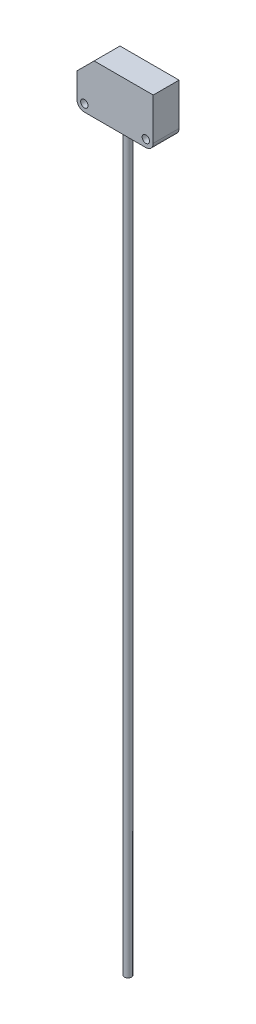
from build123d import *

# Parameters (mm, degrees)
BOSS_EXTRU_1_DEPTH      = 10.5
ESQUISSE2_R             = 1.5
ENL_V_MAT_EXTRU_1_DEPTH = 39.356876828
CONG_1_R                = 3
ESQUISSE3_W             = 18
ESQUISSE3_H             = 10.5
BOSS_EXTRU_2_DEPTH      = 0.01
ESQUISSE4_R             = 1.5
BOSS_EXTRU_3_DEPTH      = 300


with BuildPart() as part:
    # Esquisse1 → Boss.-Extru.1 (new body)
    with BuildSketch(Plane.XY):
        Polygon((0, 0), (31, 0), (31, 20), (7, 20), (0, 13), align=None)
    extrude(amount=-BOSS_EXTRU_1_DEPTH)

    # Esquisse2 → Enlèv. mat.-Extru.1 (cut, through all)
    with BuildSketch(Plane.XY):
        with Locations((3, 3)):
            Circle(ESQUISSE2_R)
        with Locations((28, 3)):
            Circle(ESQUISSE2_R)
    extrude(amount=-ENL_V_MAT_EXTRU_1_DEPTH, mode=Mode.SUBTRACT)

    # Congé1
    cong_1_edges = [part.edges().sort_by_distance(p)[0] for p in [
        (31, 0, -5.25),
        (0, 0, -5.25),
    ]]
    fillet(cong_1_edges, radius=CONG_1_R)

    # Esquisse3 → Boss.-Extru.2 (add)
    with BuildSketch(Plane.XZ):
        with Locations((15.5, -5.25)):
            Rectangle(ESQUISSE3_W, ESQUISSE3_H)
    extrude(amount=BOSS_EXTRU_2_DEPTH)

    # Esquisse4 → Boss.-Extru.3 (add)
    with BuildSketch(Plane.XZ.offset(0.01)):
        with Locations((15.5, -5.25)):
            Circle(ESQUISSE4_R)
    extrude(amount=BOSS_EXTRU_3_DEPTH)


solid = part.part
